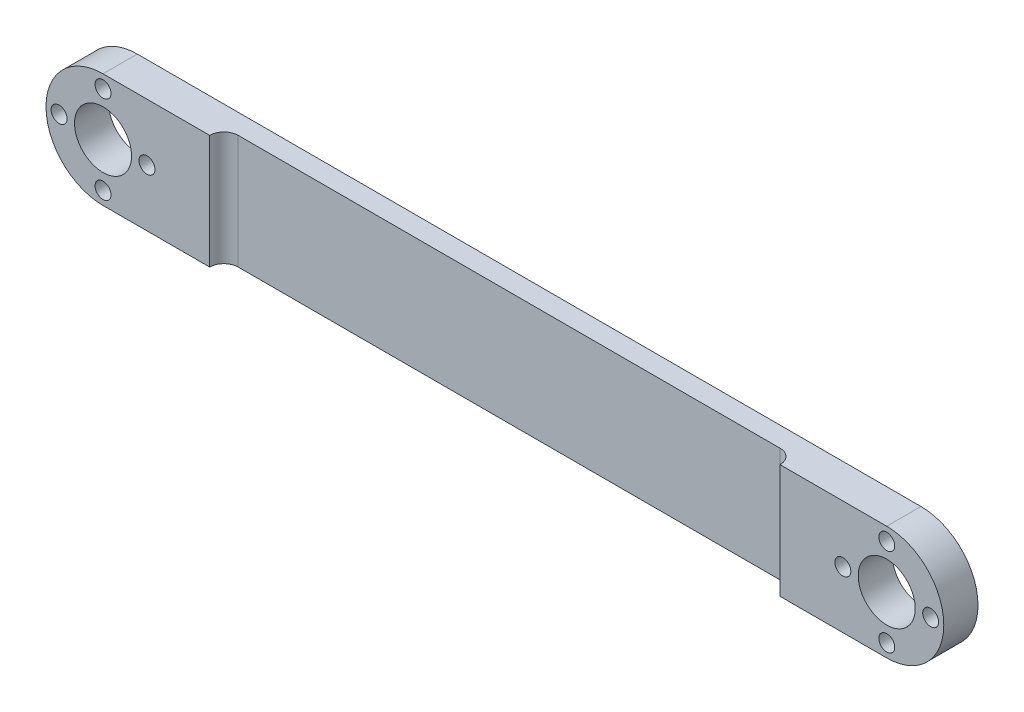
from build123d import *

# Parameters (mm, degrees)
SKETCH1_R               = 12.7
BOSS_EXTRUDE1_DEPTH     = 7.62
SKETCH2_R               = 6.35
CUT_EXTRUDE1_DEPTH      = 7.62
SKETCH3_R               = 1.778
CUT_EXTRUDE2_DEPTH      = 7.62
CIRPATTERN1_COUNT       = 4
MIRROR1_COPY_1_SKETCH_R = 1.778
MIRROR1_COPY_1_DEPTH    = 7.62
MIRROR1_COPY_2_SKETCH_R = 1.778
MIRROR1_COPY_2_DEPTH    = 7.62
MIRROR1_COPY_3_SKETCH_R = 1.778
MIRROR1_COPY_3_DEPTH    = 7.62
SKETCH4_W               = 127
SKETCH4_H               = 3.175
CUT_EXTRUDE3_DEPTH      = 25.4
FILLET1_R               = 3.175


with BuildPart() as part:
    # Sketch1 → Boss-Extrude1 (new body)
    with BuildSketch(Plane.XY):
        with BuildLine():
            ThreePointArc((-12.7, -25.4), (-25.4, -12.7), (-12.7, 0))
            Line((-12.7, 0), (-187.198, 0))
            ThreePointArc((-187.198, 0), (-178.217743879, -3.719743879), (-174.498, -12.7))
            ThreePointArc((-174.498, -12.7), (-178.217743879, -21.680256121), (-187.198, -25.4))
            Line((-187.198, -25.4), (-12.7, -25.4))
        make_face()
        with Locations((-187.198, -12.7)):
            Circle(SKETCH1_R)
        with Locations((-12.7, -12.7)):
            Circle(SKETCH1_R)
    extrude(amount=BOSS_EXTRUDE1_DEPTH)

    # Sketch2 → Cut-Extrude1 (cut)
    with BuildSketch(Plane.XY.offset(7.62)):
        with Locations((-12.7, -12.7)):
            Circle(SKETCH2_R)
    cut_extrude1 = extrude(amount=-CUT_EXTRUDE1_DEPTH, mode=Mode.SUBTRACT)

    # Sketch3 → Cut-Extrude2 (cut)
    with BuildSketch(Plane.XY.offset(7.62)):
        with Locations((-2.921, -12.7)):
            Circle(SKETCH3_R)
    cut_extrude2 = extrude(amount=-CUT_EXTRUDE2_DEPTH, mode=Mode.SUBTRACT)

    # CirPattern1: Cut-Extrude2 ×4 about axis
    cirpattern1_axis = Axis((-12.7, -12.7, 0), (0, 0, 1))
    for i in range(1, CIRPATTERN1_COUNT):
        add(cut_extrude2.rotate(cirpattern1_axis, i * 360 / CIRPATTERN1_COUNT), mode=Mode.SUBTRACT)

    # Mirror1: Cut-Extrude1, Cut-Extrude2 across plane
    add(cut_extrude1.mirror(Plane(origin=(-99.949, 0, 0), x_dir=(0, 0, 1), z_dir=(1, 0, 0))), mode=Mode.SUBTRACT)
    add(cut_extrude2.mirror(Plane(origin=(-99.949, 0, 0), x_dir=(0, 0, 1), z_dir=(1, 0, 0))), mode=Mode.SUBTRACT)

    # Mirror1 copy 1 sketch → Mirror1 copy 1 (cut)
    with BuildSketch(Plane(origin=(-174.498, 0, 7.62), x_dir=(0, 1, 0), z_dir=(0, 0, 1))):
        with Locations((-2.921, 12.7)):
            Circle(MIRROR1_COPY_1_SKETCH_R)
    extrude(amount=-MIRROR1_COPY_1_DEPTH, mode=Mode.SUBTRACT)

    # Mirror1 copy 2 sketch → Mirror1 copy 2 (cut)
    with BuildSketch(Plane(origin=(-174.498, -25.4, 7.62), x_dir=(1, 0, 0), z_dir=(0, 0, 1))):
        with Locations((-2.921, 12.7)):
            Circle(MIRROR1_COPY_2_SKETCH_R)
    extrude(amount=-MIRROR1_COPY_2_DEPTH, mode=Mode.SUBTRACT)

    # Mirror1 copy 3 sketch → Mirror1 copy 3 (cut)
    with BuildSketch(Plane(origin=(-199.898, -25.4, 7.62), x_dir=(0, -1, 0), z_dir=(0, 0, 1))):
        with Locations((-2.921, 12.7)):
            Circle(MIRROR1_COPY_3_SKETCH_R)
    extrude(amount=-MIRROR1_COPY_3_DEPTH, mode=Mode.SUBTRACT)

    # Sketch4 → Cut-Extrude3 (cut)
    with BuildSketch(Plane.XZ.offset(25.4)):
        with Locations((-99.949, 6.0325)):
            Rectangle(SKETCH4_W, SKETCH4_H)
    extrude(amount=-CUT_EXTRUDE3_DEPTH, mode=Mode.SUBTRACT)

    # Fillet1
    fillet1_edges = [part.edges().sort_by_distance(p)[0] for p in [
        (-36.449, -12.7, 4.445),
        (-163.449, -12.7, 4.445),
    ]]
    fillet(fillet1_edges, radius=FILLET1_R - 0.0001)  # a hair under: the kernel refuses the full size


solid = part.part
